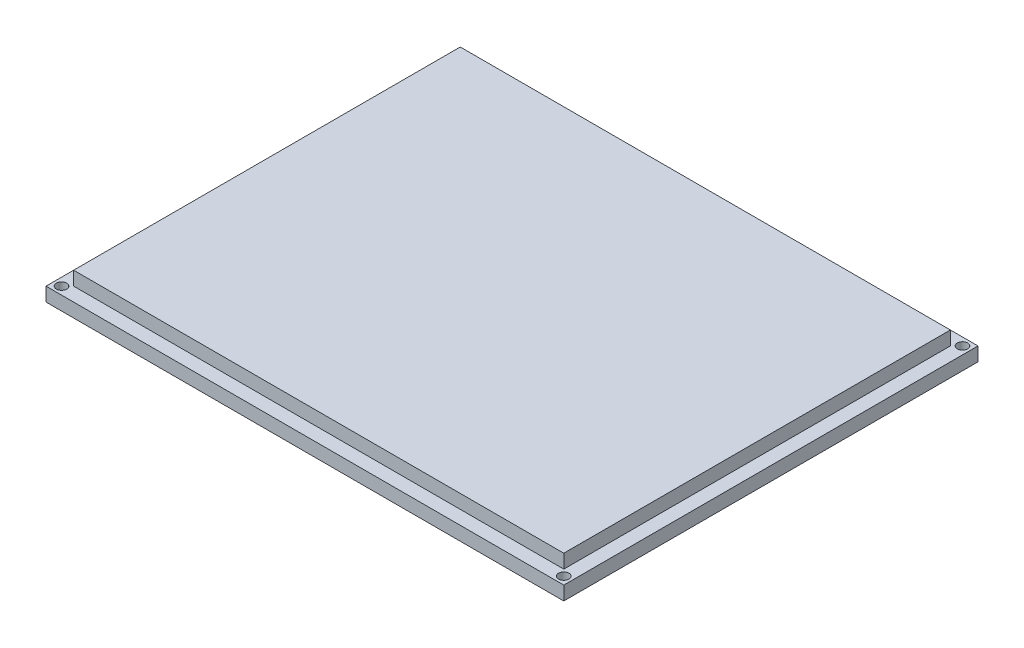
from build123d import *

# Parameters (mm, degrees)
SKETCH1_W               = 150
SKETCH1_H               = 120
TOP_DEPTH               = 4
SKETCH2_W               = 142
SKETCH2_H               = 112
BOTTOM_DEPTH            = 4
HOLE_REACH              = 123
SKETCH4_R               = 1.5
HOLE_PATTERN_COUNT      = 2
HOLE_PATTERN_PITCH      = 115.5
HOLE_PATTERN_COUNT_DIR2 = 2
HOLE_PATTERN_PITCH_DIR2 = 145.5


with BuildPart() as part:
    # Sketch1 → Top (new body)
    with BuildSketch(Plane(origin=(0, 0, 0), x_dir=(1, 0, 0), z_dir=(0, 1, 0))):
        with Locations((-30, 0)):
            Rectangle(SKETCH1_W, SKETCH1_H)
    extrude(amount=TOP_DEPTH)

    # Sketch2 → Bottom (add)
    with BuildSketch(Plane(origin=(0, 4, 0), x_dir=(1, 0, 0), z_dir=(0, 1, 0))):
        with Locations((-30, 0)):
            Rectangle(SKETCH2_W, SKETCH2_H)
    extrude(amount=BOTTOM_DEPTH)

    # Sketch4 → Hole (cut, up to next)
    with BuildSketch(Plane(origin=(0, 4, 0), x_dir=(1, 0, 0), z_dir=(0, 1, 0)), mode=Mode.PRIVATE) as hole_sk1:
        with Locations((-102.75, -57.75)):
            Circle(SKETCH4_R)
    hole_tool1 = extrude(hole_sk1.sketch, amount=-HOLE_REACH, mode=Mode.PRIVATE) & part.part
    hole = hole_tool1.solids().sort_by_distance((-102.75, 4, 57.75))[0]
    add(hole, mode=Mode.SUBTRACT)

    # Hole-Pattern: Hole 2 × 2
    with Locations(*[(j * HOLE_PATTERN_PITCH_DIR2, 0, -i * HOLE_PATTERN_PITCH) for i in range(HOLE_PATTERN_COUNT) for j in range(HOLE_PATTERN_COUNT_DIR2) if (i, j) != (0, 0)]):
        add(hole, mode=Mode.SUBTRACT)


solid = part.part
